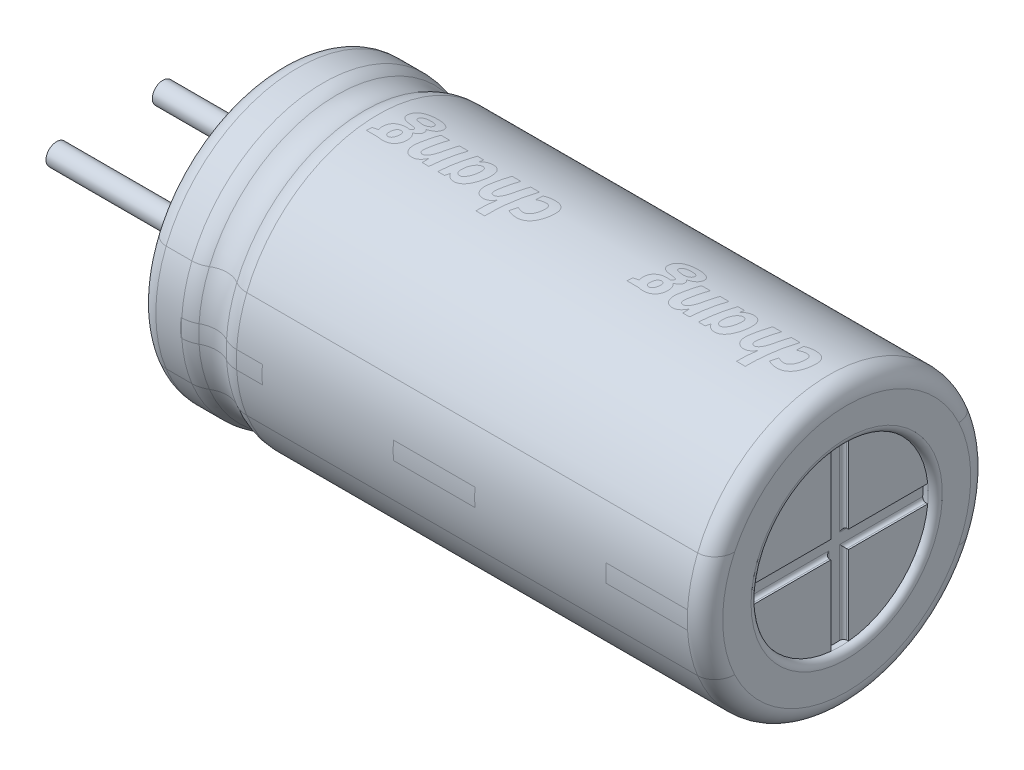
from build123d import *

# Parameters (mm, degrees)
FILLET_1_R          = 0.8
SKETCH_2_R          = 2.5
CUT_EXTRUDE_1_DEPTH = 0.2
FILLET_2_R          = 0.5
CUT_EXTRUDE_2_DEPTH = 0.15
FILLET_3_R          = 0.1
CUT_EXTRUDE_START   = -0.2
SKETCH_5_R          = 2.5
CUT_EXTRUDE_3_DEPTH = 0.2
SKETCH_6_R          = 0.3
EXTRUDE_2_DEPTH     = 5
FILLET_4_R          = 0.5
FILLET_6_R          = 0.2
FILLET_5_R          = 0.2


with BuildPart() as part:
    # Эскиз1 → Повернуть1 (revolve)
    with BuildSketch(Plane.XY, mode=Mode.PRIVATE) as revolve_1_sk:
        with BuildLine():
            Line((0, 0), (0, 4))
            Line((0, 4), (1.470849738, 4))
            ThreePointArc((1.470849738, 4), (2, 3.8), (2.529150262, 4))
            Line((2.529150262, 4), (16, 4))
            Line((16, 4), (16, 0))
            Line((16, 0), (0, 0))
        make_face()
    revolve(revolve_1_sk.sketch.rotate(Axis((-7.119144013, 0, 0), (1, 0, 0)), 90), axis=Axis((-7.119144013, 0, 0), (1, 0, 0)))

    # Скругление1
    fillet_1_edges = [part.edges().sort_by_distance(p)[0] for p in [
        (1.470849738, 0, -4),
        (2.529150262, 0, -4),
    ]]
    fillet(fillet_1_edges, radius=FILLET_1_R)

    # Эскиз2 → Вырез-Вытянуть1 (cut)
    with BuildSketch(Plane(origin=(16, 0, 0), x_dir=(0, 0, -1), z_dir=(1, 0, 0))):
        Circle(SKETCH_2_R)
    extrude(amount=-CUT_EXTRUDE_1_DEPTH, mode=Mode.SUBTRACT)

    # Скругление2
    fillet_2_edges = [part.edges().sort_by_distance(p)[0] for p in [
        (16, 0, -4),
    ]]
    fillet(fillet_2_edges, radius=FILLET_2_R)

    # Эскиз4 → Вырез-Вытянуть2 (cut)
    with BuildSketch(Plane(origin=(15.8, 0, 0), x_dir=(0, 0, -1), z_dir=(1, 0, 0))):
        with BuildLine():
            Line((-0.25, 2.487468593), (-0.25, 0.25))
            Line((-0.25, 0.25), (-2.487468593, 0.25))
            ThreePointArc((-2.487468593, 0.25), (-2.5, 0), (-2.487468593, -0.25))
            Line((-2.487468593, -0.25), (-0.25, -0.25))
            Line((-0.25, -0.25), (-0.25, -2.487468593))
            ThreePointArc((-0.25, -2.487468593), (0, -2.5), (0.25, -2.487468593))
            Line((0.25, -2.487468593), (0.25, -0.25))
            Line((0.25, -0.25), (2.487468593, -0.25))
            ThreePointArc((2.487468593, -0.25), (2.5, 0), (2.487468593, 0.25))
            Line((2.487468593, 0.25), (0.25, 0.25))
            Line((0.25, 0.25), (0.25, 2.487468593))
            ThreePointArc((0.25, 2.487468593), (0, 2.5), (-0.25, 2.487468593))
        make_face()
    extrude(amount=-CUT_EXTRUDE_2_DEPTH, mode=Mode.SUBTRACT)

    # Скругление3
    fillet_3_edges = [part.edges().sort_by_distance(p)[0] for p in [
        (15.65, 1.368734296, -0.25),
        (15.65, 0.25, -1.368734296),
        (15.65, -0.25, -1.368734296),
        (15.65, -1.368734296, -0.25),
        (15.65, -1.368734296, 0.25),
        (15.65, -0.25, 1.368734296),
        (15.65, 0.25, 1.368734296),
        (15.65, 1.368734296, 0.25),
    ]]
    fillet(fillet_3_edges, radius=FILLET_3_R)

    # Эскиз5 → Вырез-Вытянуть3 (cut)
    with BuildSketch(Plane.ZY.offset(CUT_EXTRUDE_START)):
        with Locations(Location((0, 0, 0), (0, 0, 180))):
            Circle(SKETCH_5_R)
    extrude(amount=CUT_EXTRUDE_3_DEPTH, mode=Mode.SUBTRACT)

    # Эскиз6 → Бобышка-Вытянуть2 (add)
    with BuildSketch(Plane.ZY.offset(-0.2)):
        with Locations((-1.5, 0)):
            Circle(SKETCH_6_R)
        with Locations(Location((1.5, 0, 0), (0, 0, 180))):
            Circle(SKETCH_6_R)
    extrude(amount=EXTRUDE_2_DEPTH)

    # Скругление4
    fillet_4_edges = [part.edges().sort_by_distance(p)[0] for p in [
        (0, 0, -4),
    ]]
    fillet(fillet_4_edges, radius=FILLET_4_R)

    # Скругление6
    fillet_6_edges = [part.edges().sort_by_distance(p)[0] for p in [
        (0, 0, 2.5),
    ]]
    fillet(fillet_6_edges, radius=FILLET_6_R - 0.0001)  # a hair under: the kernel refuses the full size

    # Скругление5
    fillet_5_edges = [part.edges().sort_by_distance(p)[0] for p in [
        (16, 0, 2.5),
    ]]
    fillet(fillet_5_edges, radius=FILLET_5_R - 0.0001)  # a hair under: the kernel refuses the full size


solid = part.part
